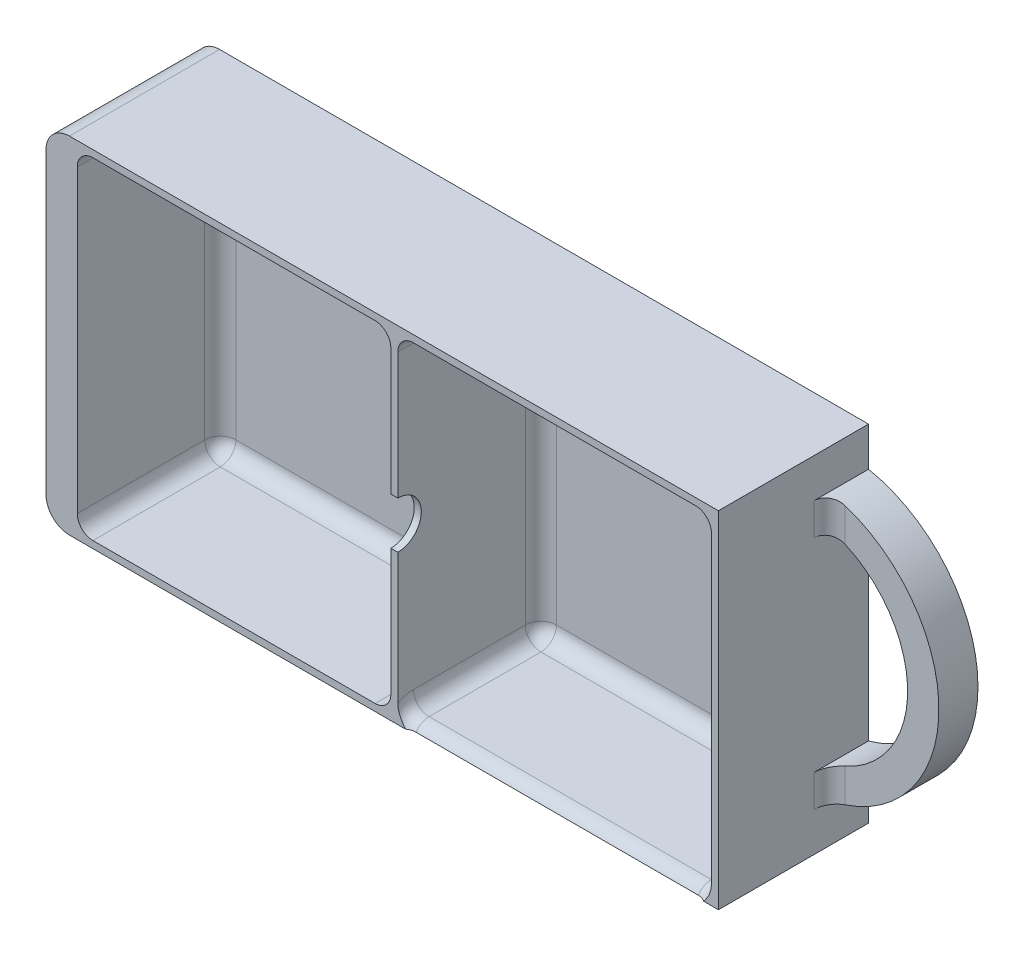
from build123d import *

# Parameters (mm, degrees)
SKETCH_1_W                  = 86
SKETCH_1_H                  = 44.2
EXTRUDE_1_DEPTH             = 14.2
EXTRUDE_2_DEPTH             = 5
SKETCH_3_W                  = 40.1
SKETCH_3_H                  = 42.4
CUT_EXTRUDE_1_DEPTH         = 18.3
SKETCH_4_W                  = 40.1
SKETCH_4_H                  = 42.4
CUT_EXTRUDE_2_DEPTH         = 18.3
HOLE_WIZARD_8_3_8_3_1_D     = 8.3
HOLE_WIZARD_8_3_8_3_1_DEPTH = 3.2
HOLE_WIZARD_6_0_6_1_D       = 6
HOLE_WIZARD_6_0_6_1_DEPTH   = 0.9
FILLET_1_R                  = 3
EXTRUDE_START               = -3.5
SKETCH_9_R                  = 4.15
EXTRUDE_3_DEPTH             = 3.5
FILLET_2_R                  = 2
FILLET_3_R                  = 2
FILLET_4_R                  = 2
FILLET_5_R                  = 2


with BuildPart() as part:
    # Эскиз1 → Бобышка-Вытянуть1 (new body)
    with BuildSketch(Plane.XY.offset(9.6)):
        with Locations((47, 0)):
            Rectangle(SKETCH_1_W, SKETCH_1_H)
    extrude(amount=-EXTRUDE_1_DEPTH)

    # Эскиз2 → Бобышка-Вытянуть2 (add)
    with BuildSketch(Plane(origin=(0, 0, -4.6), x_dir=(-1, 0, 0), z_dir=(0, 0, -1))):
        with BuildLine():
            Line((-90, -22.1), (-90, -17.1))
            ThreePointArc((-90, -17.1), (-104, 0), (-90, 17.1))
            Line((-90, 17.1), (-90, 22.1))
            Line((-90, 22.1), (-4, 22.1))
            Line((-4, 22.1), (-4, -22.1))
            Line((-4, -22.1), (-90, -22.1))
        make_face()
        with BuildLine():
            Line((-90, -12.994779171), (-90, 12.994779171))
            ThreePointArc((-90, 12.994779171), (-100, 0), (-90, -12.994779171))
        make_face(mode=Mode.SUBTRACT)
    extrude(amount=EXTRUDE_2_DEPTH)

    # Эскиз3 → Вырез-Вытянуть1 (cut)
    with BuildSketch(Plane.XY.offset(9.6)):
        with Locations((28.05, 0)):
            Rectangle(SKETCH_3_W, SKETCH_3_H)
    extrude(amount=-CUT_EXTRUDE_1_DEPTH, mode=Mode.SUBTRACT)

    # Эскиз4 → Вырез-Вытянуть2 (cut)
    with BuildSketch(Plane.XY.offset(9.6)):
        with Locations((69.05, 0)):
            Rectangle(SKETCH_4_W, SKETCH_4_H)
    extrude(amount=-CUT_EXTRUDE_2_DEPTH, mode=Mode.SUBTRACT)

    # Диаметр отверстия Ø8.3 (8.3)1
    with Locations(Plane.ZY.offset(-4)):
        with Locations((0, 0)):
            Hole(HOLE_WIZARD_8_3_8_3_1_D / 2, depth=HOLE_WIZARD_8_3_8_3_1_DEPTH)

    # Диаметр отверстия Ø6.0 (6)1
    with Locations(Plane.ZY.offset(-48.1)):
        with Locations((9.6, 0)):
            Hole(HOLE_WIZARD_6_0_6_1_D / 2, depth=HOLE_WIZARD_6_0_6_1_DEPTH)

    # Скругление1
    fillet_1_edges = [part.edges().sort_by_distance(p)[0] for p in [
        (4, -22.1, 0),
        (4, 22.1, 0),
    ]]
    fillet(fillet_1_edges, radius=FILLET_1_R)

    # Эскиз9 → Бобышка-Вытянуть3 (add)
    with BuildSketch(Plane.ZY.offset(-4).offset(EXTRUDE_START)):
        Circle(SKETCH_9_R)
    extrude(amount=EXTRUDE_3_DEPTH)

    # Скругление2
    # the kernel refuses this fillet: 2 mm, written as the material it adds along each edge
    with BuildSketch(Plane(origin=(51, 19.2, -6.7), x_dir=(0, 1, 0), z_dir=(-1, 0, 0))) as fillet_2_piece_1_section:
        Polygon((0, 0), (FILLET_2_R * 1.02, 0), (FILLET_2_R * 1.02, FILLET_2_R * 1.02), (0, FILLET_2_R * 1.02), align=None)
    fillet_2_piece_1 = extrude(amount=FILLET_2_R * 1.02, mode=Mode.PRIVATE)
    fillet_2_piece_1 = fillet_2_piece_1 - Plane(origin=(51, 19.2, -6.7), x_dir=(0, -0.7071067811865475, 0.7071067811865475), z_dir=(-1, 0, 0)) * Sphere(FILLET_2_R, mode=Mode.PRIVATE)
    add(fillet_2_piece_1)
    with BuildSketch(Plane(origin=(46.1, -19.2, -6.7), x_dir=(0, 0, -1), z_dir=(0, -1, 0))) as fillet_2_piece_2_section:
        Polygon((0, 0), (FILLET_2_R * 1.02, 0), (FILLET_2_R * 1.02, FILLET_2_R * 1.02), (0, FILLET_2_R * 1.02), align=None)
    fillet_2_piece_2 = extrude(amount=FILLET_2_R * 1.02, mode=Mode.PRIVATE)
    fillet_2_piece_2 = fillet_2_piece_2 - Plane(origin=(46.1, -19.2, -6.7), x_dir=(-0.7071067811865475, 0, 0.7071067811865475), z_dir=(0, -1, 0)) * Sphere(FILLET_2_R, mode=Mode.PRIVATE)
    add(fillet_2_piece_2)
    with BuildSketch(Plane(origin=(10, -19.2, -6.7), x_dir=(-1, 0, 0), z_dir=(0, 0, -1))) as fillet_2_piece_3_section:
        Polygon((0, 0), (FILLET_2_R * 1.02, 0), (FILLET_2_R * 1.02, -FILLET_2_R * 1.02), (0, -FILLET_2_R * 1.02), align=None)
    fillet_2_piece_3 = extrude(amount=FILLET_2_R * 1.02, mode=Mode.PRIVATE)
    fillet_2_piece_3 = fillet_2_piece_3 - Plane(origin=(10, -19.2, -6.7), x_dir=(0.707106781186543, 0.7071067811865519, 0), z_dir=(0, 0, -1)) * Sphere(FILLET_2_R, mode=Mode.PRIVATE)
    add(fillet_2_piece_3)
    with BuildSketch(Plane(origin=(10, 19.2, -6.7), x_dir=(0, 1, 0), z_dir=(0, 0, -1))) as fillet_2_piece_4_section:
        Polygon((0, 0), (FILLET_2_R * 1.02, 0), (FILLET_2_R * 1.02, -FILLET_2_R * 1.02), (0, -FILLET_2_R * 1.02), align=None)
    fillet_2_piece_4 = extrude(amount=FILLET_2_R * 1.02, mode=Mode.PRIVATE)
    fillet_2_piece_4 = fillet_2_piece_4 - Plane(origin=(10, 19.2, -6.7), x_dir=(0.7071067811865475, -0.7071067811865475, 0), z_dir=(0, 0, -1)) * Sphere(FILLET_2_R, mode=Mode.PRIVATE)
    add(fillet_2_piece_4)
    with BuildSketch(Plane(origin=(89.1, -21.2, -8.7), x_dir=(0, 0, 1), z_dir=(0, 1, 0))) as fillet_2_piece_5:
        with BuildLine():
            CenterArc((FILLET_2_R, -FILLET_2_R), FILLET_2_R, 90, 90)
            Line((0, -FILLET_2_R), (0, 0))
            Line((0, 0), (FILLET_2_R, 0))
        make_face()
    extrude(amount=42.4)
    with BuildSketch(Plane(origin=(89.1, 21.2, -8.7), x_dir=(0, 0, 1), z_dir=(-1, 0, 0))) as fillet_2_piece_6:
        with BuildLine():
            CenterArc((FILLET_2_R, -FILLET_2_R), FILLET_2_R, 90, 90)
            Line((0, -FILLET_2_R), (0, 0))
            Line((0, 0), (FILLET_2_R, 0))
        make_face()
    extrude(amount=38.1)
    with BuildSketch(Plane(origin=(49, 21.2, 9.6), x_dir=(0, -1, 0), z_dir=(0, 0, -1)), Plane(origin=(48.1, -21.2, 9.6), x_dir=(0, 1, 0), z_dir=(0, 0, -1))) as fillet_2_piece_7:
        with BuildLine():
            CenterArc((FILLET_2_R, -FILLET_2_R), FILLET_2_R, 90, 90)
            Line((0, -FILLET_2_R), (0, 0))
            Line((0, 0), (FILLET_2_R, 0))
        make_face()
    extrude(amount=16.3)
    with BuildSketch(Plane(origin=(8, -21.2, 9.6), x_dir=(0, 1, 0), z_dir=(0, 0, -1)), Plane(origin=(8, 21.2, 9.6), x_dir=(1, 0, 0), z_dir=(0, 0, -1))) as fillet_2_piece_8:
        with BuildLine():
            CenterArc((FILLET_2_R, FILLET_2_R), FILLET_2_R, 180, 90)
            Line((0, FILLET_2_R), (0, 0))
            Line((0, 0), (FILLET_2_R, 0))
        make_face()
    extrude(amount=16.3)
    with BuildSketch(Plane(origin=(49, 19.2, -8.7), x_dir=(0, 0, 1), z_dir=(0, -1, 0)), Plane(origin=(48.1, -19.2, -8.7), x_dir=(0, 0, 1), z_dir=(0, 1, 0))) as fillet_2_piece_9:
        with BuildLine():
            CenterArc((FILLET_2_R, -FILLET_2_R), FILLET_2_R, 90, 90)
            Line((0, -FILLET_2_R), (0, 0))
            Line((0, 0), (FILLET_2_R, 0))
        make_face()
    extrude(amount=40.4)
    with BuildSketch(Plane(origin=(53.1, 21.2, -8.7), x_dir=(0, 0, 1), z_dir=(-1, 0, 0))) as fillet_2_piece_10:
        with BuildLine():
            CenterArc((FILLET_2_R, -FILLET_2_R), FILLET_2_R, 90, 90)
            Line((0, -FILLET_2_R), (0, 0))
            Line((0, 0), (FILLET_2_R, 0))
        make_face()
    extrude(amount=43.1)
    with BuildSketch(Plane(origin=(10, -21.2, -8.7), x_dir=(0, 0, 1), z_dir=(1, 0, 0))) as fillet_2_piece_11:
        with BuildLine():
            CenterArc((FILLET_2_R, -FILLET_2_R), FILLET_2_R, 90, 90)
            Line((0, -FILLET_2_R), (0, 0))
            Line((0, 0), (FILLET_2_R, 0))
        make_face()
    extrude(amount=36.1)
    with BuildSketch(Plane(origin=(8, 19.2, -8.7), x_dir=(0, 0, 1), z_dir=(0, -1, 0))) as fillet_2_piece_12:
        with BuildLine():
            CenterArc((FILLET_2_R, -FILLET_2_R), FILLET_2_R, 90, 90)
            Line((0, -FILLET_2_R), (0, 0))
            Line((0, 0), (FILLET_2_R, 0))
        make_face()
    extrude(amount=38.4)
    # the kernel refuses this fillet: 2 mm, written as the material it takes off along each edge
    with BuildSketch(Plane(origin=(49, -21.2, 9.6), x_dir=(0, -1, 0), z_dir=(1, 0, 0))) as fillet_2_2_piece_1:
        with BuildLine():
            CenterArc((FILLET_2_R, FILLET_2_R), FILLET_2_R, 180, 90)
            Line((0, FILLET_2_R), (0, 0))
            Line((0, 0), (FILLET_2_R, 0))
        make_face()
    extrude(amount=40.1, mode=Mode.SUBTRACT)

    # Скругление3
    # the kernel refuses this fillet: 2 mm, written as the material it adds along each edge
    with BuildSketch(Plane(origin=(46.1, 19.2, -6.7), x_dir=(0, 1, 0), z_dir=(1, 0, 0))) as fillet_3_piece_1_section:
        Polygon((0, 0), (FILLET_3_R, 0), (FILLET_3_R, -FILLET_3_R), (0, -FILLET_3_R), align=None)
    fillet_3_piece_1 = extrude(amount=FILLET_3_R, mode=Mode.PRIVATE)
    fillet_3_piece_1 = fillet_3_piece_1 - Plane(origin=(46.1, 19.2, -6.7), x_dir=(0, -0.7071067811865475, 0.7071067811865475), z_dir=(1, 0, 0)) * Sphere(FILLET_3_R, mode=Mode.PRIVATE)
    add(fillet_3_piece_1)
    with BuildSketch(Plane(origin=(89.1, -23.2, 7.6), x_dir=(0, 1, 0), z_dir=(0, 0, -1))) as fillet_3_piece_2_section:
        with BuildLine():
            CenterArc((2 + FILLET_3_R, -FILLET_3_R), FILLET_3_R, 90, 90)
            Line((2, -FILLET_3_R), (2, 0))
            Line((2, 0), (2 + FILLET_3_R, 0))
        make_face()
    fillet_3_piece_2 = revolve(axis=Axis((89.1, -23.2, 7.6), (1, 0, 0)), revolution_arc=199.895215799, mode=Mode.PRIVATE)
    fillet_3_piece_2 = split(fillet_3_piece_2, bisect_by=Plane(origin=(88.655987969, -22.1, 8.63173809), z_dir=(0, 1, 0)), keep=Keep.TOP, mode=Mode.PRIVATE)
    fillet_3_piece_2 = split(fillet_3_piece_2, bisect_by=Plane(origin=(88.655987969, -21.07116748, 9.6), z_dir=(0, 0, -1)), keep=Keep.TOP, mode=Mode.PRIVATE)
    add(fillet_3_piece_2)
    with BuildSketch(Plane(origin=(89.1, -21.2, 7.6), x_dir=(0, 1, 0), z_dir=(0, 0, -1))) as fillet_3_piece_3:
        with BuildLine():
            CenterArc((FILLET_3_R, -FILLET_3_R), FILLET_3_R, 90, 90)
            Line((0, -FILLET_3_R), (0, 0))
            Line((0, 0), (FILLET_3_R, 0))
        make_face()
    extrude(amount=14.3)
    with BuildSketch(Plane(origin=(87.1, -21.2, -6.7), x_dir=(1, 0, 0), z_dir=(0, 0, 1))) as fillet_3_piece_4:
        with BuildLine():
            CenterArc((2 - FILLET_3_R, FILLET_3_R), FILLET_3_R, 270, 90)
            Line((2 - FILLET_3_R, 0), (2, 0))
            Line((2, 0), (2, FILLET_3_R))
        make_face()
    revolve(axis=Axis((87.1, -21.2, -6.7), (0, 1, 0)), revolution_arc=90)
    with BuildSketch(Plane(origin=(51, -21.2, -8.7), x_dir=(0, 1, 0), z_dir=(1, 0, 0))) as fillet_3_piece_5:
        with BuildLine():
            CenterArc((FILLET_3_R, FILLET_3_R), FILLET_3_R, 180, 90)
            Line((0, FILLET_3_R), (0, 0))
            Line((0, 0), (FILLET_3_R, 0))
        make_face()
    extrude(amount=36.1)
    with BuildSketch(Plane(origin=(51, -21.2, -6.7), x_dir=(-1, 0, 0), z_dir=(0, 0, 1))) as fillet_3_piece_6:
        with BuildLine():
            CenterArc((2 - FILLET_3_R, -FILLET_3_R), FILLET_3_R, 360, 90)
            Line((2, -FILLET_3_R), (2, 0))
            Line((2, 0), (2 - FILLET_3_R, 0))
        make_face()
    revolve(axis=Axis((51, -21.2, -6.7), (0, -1, 0)), revolution_arc=90)
    with BuildSketch(Plane(origin=(49, -23.2, 7.6), x_dir=(0, 1, 0), z_dir=(0, 0, -1))) as fillet_3_piece_7_section:
        with BuildLine():
            CenterArc((2 + FILLET_3_R, FILLET_3_R), FILLET_3_R, 180, 90)
            Line((2, FILLET_3_R), (2, 0))
            Line((2, 0), (2 + FILLET_3_R, 0))
        make_face()
    fillet_3_piece_7 = revolve(axis=Axis((49, -23.2, 7.6), (1, 0, 0)), revolution_arc=199.895215799, mode=Mode.PRIVATE)
    fillet_3_piece_7 = split(fillet_3_piece_7, bisect_by=Plane(origin=(49.444012031, -22.1, 8.63173809), z_dir=(0, 1, 0)), keep=Keep.TOP, mode=Mode.PRIVATE)
    fillet_3_piece_7 = split(fillet_3_piece_7, bisect_by=Plane(origin=(49.444012031, -21.07116748, 9.6), z_dir=(0, 0, -1)), keep=Keep.TOP, mode=Mode.PRIVATE)
    add(fillet_3_piece_7)
    with BuildSketch(Plane(origin=(49, -21.2, 7.6), x_dir=(0, 1, 0), z_dir=(0, 0, -1))) as fillet_3_piece_8:
        with BuildLine():
            CenterArc((FILLET_3_R, FILLET_3_R), FILLET_3_R, 180, 90)
            Line((0, FILLET_3_R), (0, 0))
            Line((0, 0), (FILLET_3_R, 0))
        make_face()
    extrude(amount=14.3)
    with BuildSketch(Plane(origin=(48.1, 21.2, 9.6), x_dir=(0, -1, 0), z_dir=(0, 0, -1))) as fillet_3_piece_9:
        with BuildLine():
            CenterArc((FILLET_3_R, FILLET_3_R), FILLET_3_R, 180, 90)
            Line((0, FILLET_3_R), (0, 0))
            Line((0, 0), (FILLET_3_R, 0))
        make_face()
    extrude(amount=16.3)

    # Скругление4
    # the kernel refuses this fillet: 2 mm, written as the material it adds along each edge
    with BuildSketch(Plane(origin=(87.1, 19.2, -6.7), x_dir=(0, 1, 0), z_dir=(1, 0, 0))) as fillet_4_piece_1_section:
        Polygon((0, 0), (FILLET_4_R, 0), (FILLET_4_R, -FILLET_4_R), (0, -FILLET_4_R), align=None)
    fillet_4_piece_1 = extrude(amount=FILLET_4_R, mode=Mode.PRIVATE)
    fillet_4_piece_1 = fillet_4_piece_1 - Plane(origin=(87.1, 19.2, -6.7), x_dir=(0, -0.7071067811865475, 0.7071067811865475), z_dir=(1, 0, 0)) * Sphere(FILLET_4_R, mode=Mode.PRIVATE)
    add(fillet_4_piece_1)
    with BuildSketch(Plane(origin=(89.1, 21.2, 9.6), x_dir=(0, -1, 0), z_dir=(0, 0, -1))) as fillet_4_piece_2:
        with BuildLine():
            CenterArc((FILLET_4_R, FILLET_4_R), FILLET_4_R, 180, 90)
            Line((0, FILLET_4_R), (0, 0))
            Line((0, 0), (FILLET_4_R, 0))
        make_face()
    extrude(amount=16.3)

    # Скругление5
    fillet_5_edges = [part.edges().sort_by_distance(p)[0] for p in [
        (90, -15.047389586, -4.6),
        (90, 15.047389586, -4.6),
    ]]
    fillet(fillet_5_edges, radius=FILLET_5_R)


solid = part.part
